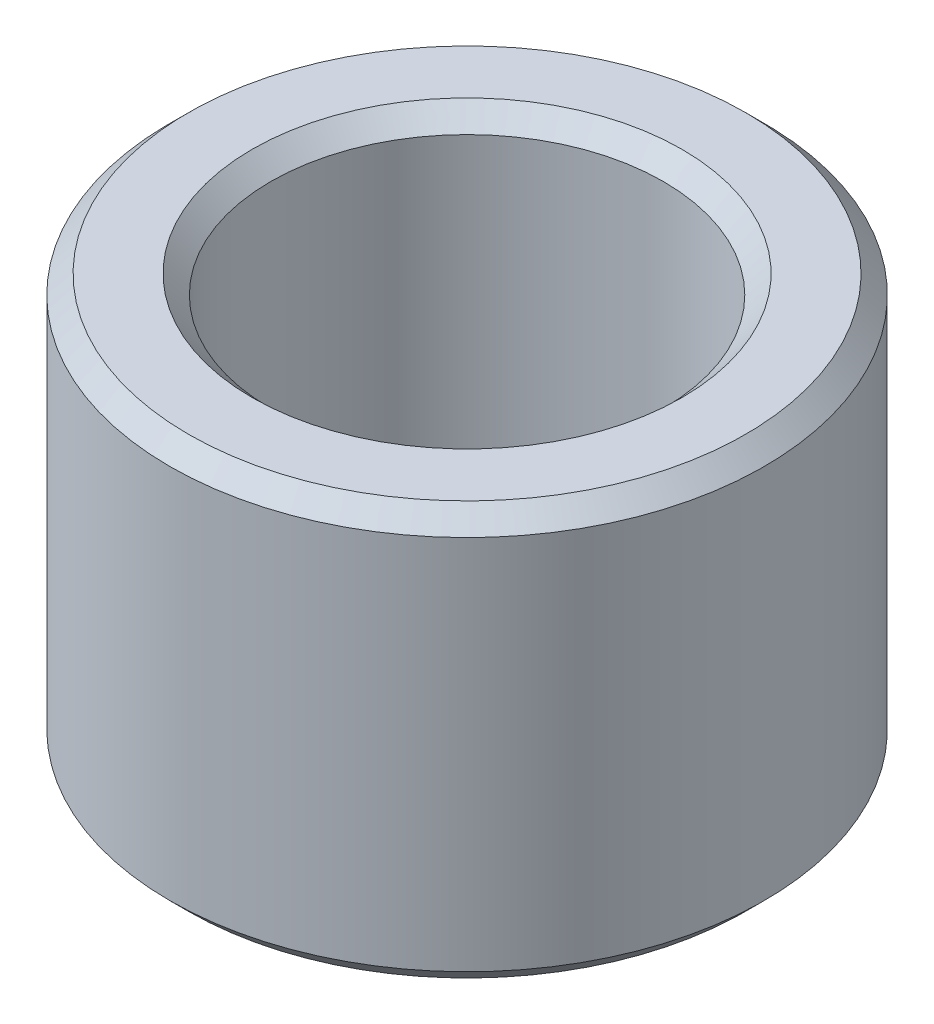
from build123d import *

# Parameters (mm, degrees)
SKETCH1_R           = 40
BOSS_EXTRUDE1_DEPTH = 55.6094222
SKETCH2_R           = 26.431840058
CUT_EXTRUDE1_DEPTH  = 80.324698785
CHAMFER1_SIZE       = 2.502738277


with BuildPart() as part:
    # Sketch1 → Boss-Extrude1 (new body)
    with BuildSketch(Plane(origin=(0, 0, 0), x_dir=(1, 0, 0), z_dir=(0, 1, 0))):
        Circle(SKETCH1_R)
    extrude(amount=BOSS_EXTRUDE1_DEPTH)

    # Sketch2 → Cut-Extrude1 (cut, through all)
    with BuildSketch(Plane(origin=(0, 0, 0), x_dir=(1, 0, 0), z_dir=(0, 1, 0))):
        Circle(SKETCH2_R)
    extrude(amount=CUT_EXTRUDE1_DEPTH, mode=Mode.SUBTRACT)

    # Chamfer1
    chamfer1_edges = [part.edges().sort_by_distance(p)[0] for p in [
        (-26.431840058, 55.6094222, 0),
        (-26.431840058, 0, 0),
        (-40, 0, 0),
        (-40, 55.6094222, 0),
    ]]
    chamfer(chamfer1_edges, length=CHAMFER1_SIZE)


solid = part.part
